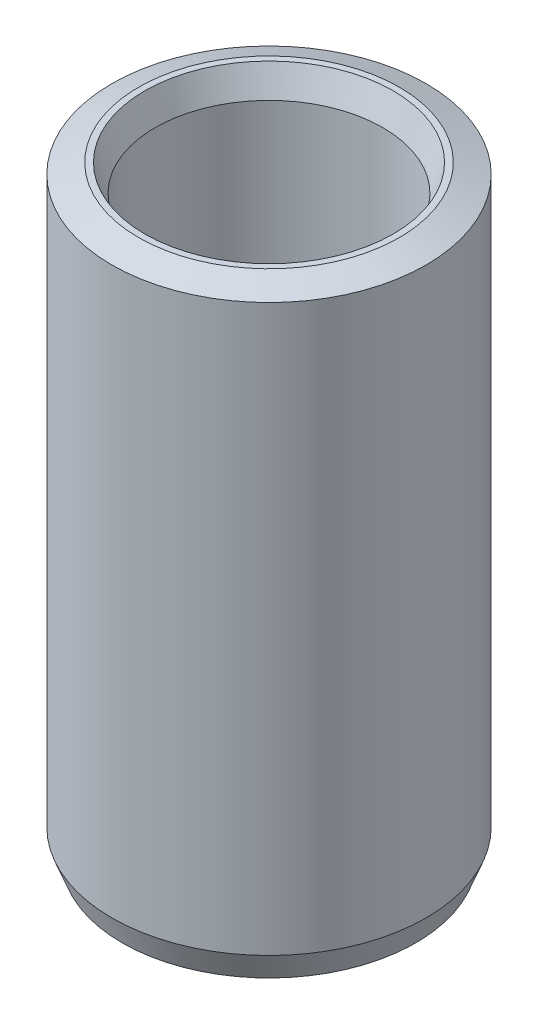
from build123d import *
from OCP.BRepFilletAPI import BRepFilletAPI_MakeChamfer

# Parameters (mm, degrees)
SKETCH1_R           = 50
BOSS_EXTRUDE1_DEPTH = 191.75840954
SKETCH2_R           = 36.228236223
CUT_EXTRUDE1_DEPTH  = 205.380252542
CHAMFER1_SIZE       = 3.278540183
CHAMFER1_SIZE2      = 8.522244817


with BuildPart() as part:
    # Sketch1 → Boss-Extrude1 (new body)
    with BuildSketch(Plane(origin=(0, 0, 0), x_dir=(1, 0, 0), z_dir=(0, 1, 0))):
        Circle(SKETCH1_R)
    extrude(amount=BOSS_EXTRUDE1_DEPTH)

    # Sketch2 → Cut-Extrude1 (cut, through all)
    with BuildSketch(Plane(origin=(0, 0, 0), x_dir=(1, 0, 0), z_dir=(0, 1, 0))):
        Circle(SKETCH2_R)
    extrude(amount=CUT_EXTRUDE1_DEPTH, mode=Mode.SUBTRACT)

    # Chamfer1: one chamfer whose edges measure the first distance from different faces: ONE call of the kernel's chamfer builder (chamfer() names one face for all edges)
    chamfer1_edges_1 = [part.edges().sort_by_distance(p)[0] for p in [
        (-36.228236223, 191.75840954, 0),
    ]]
    chamfer1_side_1 = [part.faces().sort_by_distance(p)[0] for p in [
        (-48.585786438, 191.75840954, 0),
    ]]
    chamfer1_edges_2 = [part.edges().sort_by_distance(p)[0] for p in [
        (-36.228236223, 0, 0),
    ]]
    chamfer1_side_2 = [part.faces().sort_by_distance(p)[0] for p in [
        (-36.228236223, 95.87920477, 0),
    ]]
    chamfer1_edges_3 = [part.edges().sort_by_distance(p)[0] for p in [
        (-50, 0, 0),
    ]]
    chamfer1_side_3 = [part.faces().sort_by_distance(p)[0] for p in [
        (-48.585786438, 0, 0),
    ]]
    chamfer1_edges_4 = [part.edges().sort_by_distance(p)[0] for p in [
        (-50, 191.75840954, 0),
    ]]
    chamfer1_side_4 = [part.faces().sort_by_distance(p)[0] for p in [
        (-50, 95.87920477, 0),
    ]]
    chamfer1 = BRepFilletAPI_MakeChamfer(part.part.solid().wrapped)
    for e in chamfer1_edges_1:
        chamfer1.Add(CHAMFER1_SIZE, CHAMFER1_SIZE2, e.wrapped, chamfer1_side_1[0].wrapped)  # the first distance lies on this face
    for e in chamfer1_edges_2:
        chamfer1.Add(CHAMFER1_SIZE, CHAMFER1_SIZE2, e.wrapped, chamfer1_side_2[0].wrapped)  # the first distance lies on this face
    for e in chamfer1_edges_3:
        chamfer1.Add(CHAMFER1_SIZE, CHAMFER1_SIZE2, e.wrapped, chamfer1_side_3[0].wrapped)  # the first distance lies on this face
    for e in chamfer1_edges_4:
        chamfer1.Add(CHAMFER1_SIZE, CHAMFER1_SIZE2, e.wrapped, chamfer1_side_4[0].wrapped)  # the first distance lies on this face
    add(Compound.cast(chamfer1.Shape()), mode=Mode.REPLACE)


solid = part.part
